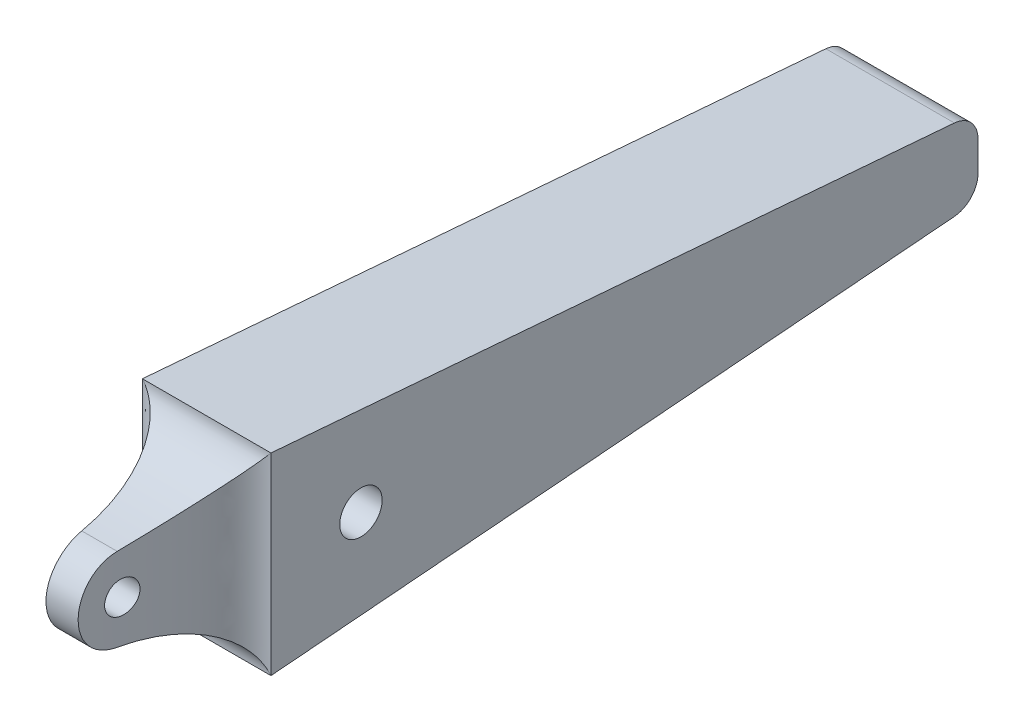
from build123d import *

# Parameters (mm, degrees)
SKETCH1_R               = 1.25
SKETCH1_R_2             = 1.65
BOSS_EXTRUDE1_DEPTH     = 10
FILLET3_R               = 2
CUT_EXTRUDE3_DEPTH      = 19.5
CUT_EXTRUDE3_DEPTH_BACK = 19.5
SKETCH4_RX              = 11.25
SKETCH4_RY              = 3.75


with BuildPart() as part:
    # Sketch1 → Boss-Extrude1 (new body)
    with BuildSketch(Plane.YZ):
        with BuildLine():
            Line((3, 0), (-3, 0))
            Line((-3, 0), (-7.5, 55))
            add(Edge.make_bspline(
                [(-7.5, 55), (-4.109267796, 55), (-3.23217472, 63.339921436)],
                knots=[3.141592654, 3.141592654, 3.141592654, 4.450740113, 4.450740113, 4.450740113], degree=2, weights=[1, 0.793307522, 1]))
            ThreePointArc((-3.23217472, 63.339921436), (0, 66.25), (3.23217472, 63.339921436))
            add(Edge.make_bspline(
                [(3.23217472, 63.339921436), (4.109267796, 55), (7.5, 55)],
                knots=[1.832445194, 1.832445194, 1.832445194, 3.141592654, 3.141592654, 3.141592654], degree=2, weights=[1, 0.793307522, 1]))
            Line((7.5, 55), (3, 0))
        make_face()
        with Locations((0, 63)):
            Circle(SKETCH1_R, mode=Mode.SUBTRACT)
        with Locations((0, 48)):
            Circle(SKETCH1_R_2, mode=Mode.SUBTRACT)
    extrude(amount=BOSS_EXTRUDE1_DEPTH)

    # Fillet3
    fillet3_edges = [part.edges().sort_by_distance(p)[0] for p in [
        (5, 3, 0),
        (5, -3, 0),
    ]]
    fillet(fillet3_edges, radius=FILLET3_R)

    # Sketch4 → Cut-Extrude3 (cut, two sides: drawn at the far end of the back side and taken through both)
    with BuildSketch(Plane(origin=(0, 0, 0), x_dir=(-1, 0, 0), z_dir=(0, 1, 0)).offset(-CUT_EXTRUDE3_DEPTH_BACK)):
        with Locations(Location((-10, 66.25), (0, 0, 90))):
            Ellipse(SKETCH4_RX, SKETCH4_RY)
        with Locations(Location((0, 66.25), (0, 0, 90))):
            Ellipse(SKETCH4_RX, SKETCH4_RY)
    extrude(amount=CUT_EXTRUDE3_DEPTH + CUT_EXTRUDE3_DEPTH_BACK, mode=Mode.SUBTRACT)


solid = part.part
